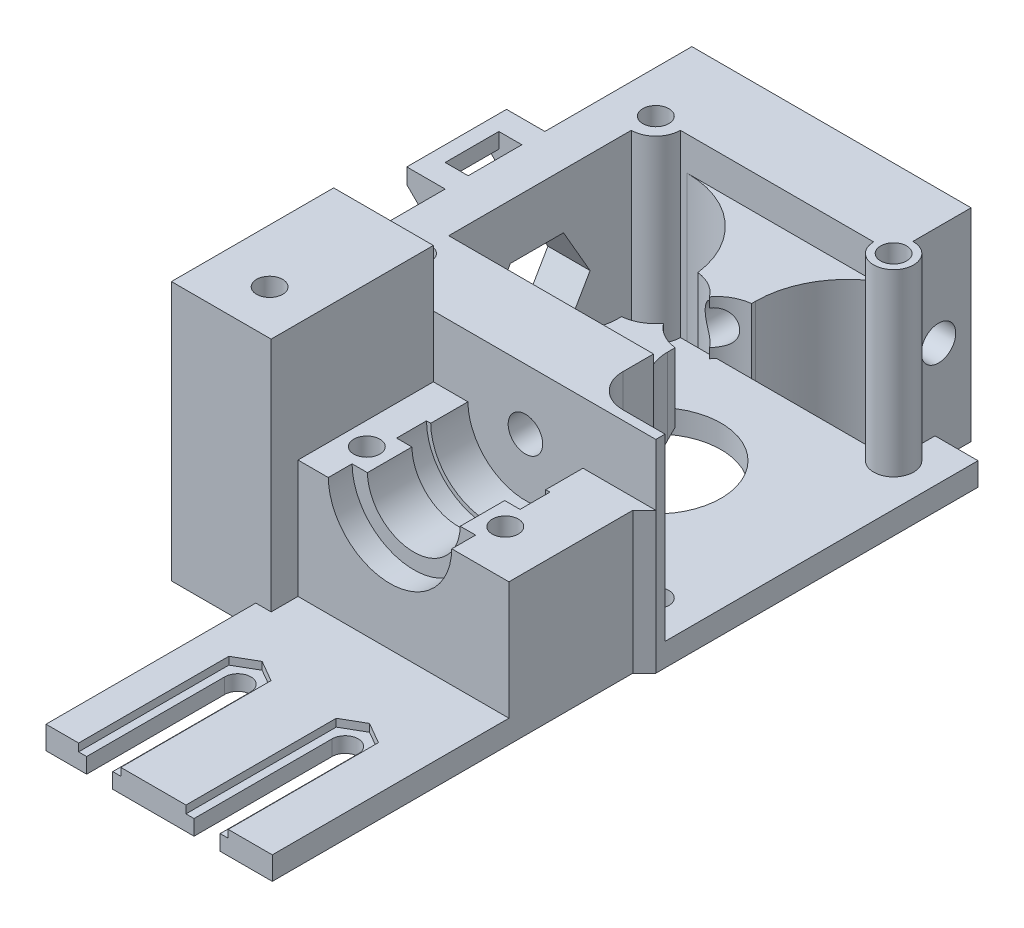
from build123d import *

# Parameters (mm, degrees)
SKETCH1_W                        = 42
SKETCH1_H                        = 90.5
SKETCH1_R                        = 8.5
BOSS_EXTRUDE1_DEPTH              = 3
SKETCH2_W                        = 24
SKETCH2_H                        = 16.65
BOSS_EXTRUDE2_DEPTH              = 15.5
SKETCH3_R                        = 6.05
CUT_EXTRUDE1_DEPTH               = 3.85
CUT_EXTRUDE2_START               = -3.85
SKETCH3_3_R                      = 8.05
CUT_EXTRUDE2_DEPTH               = 3.9
CUT_EXTRUDE3_START               = -7.75
SKETCH3_4_R                      = 6.05
CUT_EXTRUDE3_DEPTH               = 5.8
CUT_EXTRUDE4_START               = -13.55
SKETCH3_5_R                      = 8.05
CUT_EXTRUDE4_DEPTH               = 3.1
SKETCH4_R                        = 1.7
CUT_EXTRUDE5_DEPTH               = 114.237582101
SKETCH5_W                        = 13
SKETCH5_H                        = 20.15
BOSS_EXTRUDE3_DEPTH              = 30.8
CUT_EXTRUDE6_START               = 15.5
SKETCH2_2_W                      = 24
SKETCH2_2_H                      = 16.65
CUT_EXTRUDE6_DEPTH               = 0.1
CUT_EXTRUDE7_START               = 30.8
SKETCH5_5_R                      = 1.7
CUT_EXTRUDE7_DEPTH               = 147.684166304
SKETCH6_R                        = 3.25
CUT_EXTRUDE8_DEPTH               = 12.5
SKETCH7_R                        = 3.25
CUT_EXTRUDE9_DEPTH               = 3
SKETCH8_W                        = 3.5
SKETCH8_H                        = 16.65
BOSS_EXTRUDE4_DEPTH              = 15.4
SKETCH9_W                        = 1.5
SKETCH9_H                        = 48.5
CUT_EXTRUDE10_DEPTH              = 116.884166304
SKETCH19_R                       = 1.7
BOSS_EXTRUDE13_DEPTH             = 23.4
CUT_EXTRUDE20_DEPTH              = 120.590676894
CUT_EXTRUDE20_DEPTH_BACK         = 120.590676894
SKETCH19_3_R                     = 1.7
CUT_EXTRUDE21_START              = -12.5
SKETCH24_W                       = 3.4
SKETCH24_H                       = 3.4
CUT_EXTRUDE21_DEPTH              = 0.2
CUT_EXTRUDE22_START              = -3
SKETCH24_3_W                     = 3.4
SKETCH24_3_H                     = 3.4
CUT_EXTRUDE22_DEPTH              = 0.2
CUT_EXTRUDE23_START              = -12.9
SKETCH24_4_W                     = 3.4
SKETCH24_4_H                     = 3.4
CUT_EXTRUDE23_DEPTH              = 0.2
CUT_EXTRUDE24_START              = -3.4
SKETCH24_5_W                     = 3.4
SKETCH24_5_H                     = 3.4
CUT_EXTRUDE24_DEPTH              = 0.2
BOSS_EXTRUDE15_REACH             = 101.272
SKETCH26_W                       = 7
SKETCH26_H                       = 7
BOSS_EXTRUDE15_DIRECTION_2_REACH = 101.272
RIB1_REACH                       = 106.07
SKETCH28_WALL_W                  = 222.159999482
SKETCH28_WALL_H                  = 7
RIB11_START                      = -3.5
RIB11_DEPTH                      = 7
SKETCH29_R                       = 2.25
CUT_EXTRUDE25_DEPTH              = 89.232307008
SKETCH30_W                       = 36.4
SKETCH30_H                       = 4.7
BOSS_EXTRUDE16_DEPTH             = 3
SKETCH31_R                       = 2.25
CUT_EXTRUDE26_DEPTH              = 110.40511871
CUT_EXTRUDE27_START              = -7
SKETCH32_R                       = 2.25
CUT_EXTRUDE27_DEPTH              = 3
BOSS_EXTRUDE17_START             = 1
BOSS_EXTRUDE17_DEPTH             = 1
CUT_EXTRUDE28_DEPTH              = 3
CUT_EXTRUDE29_DEPTH              = 1
SKETCH36_R                       = 7.5
CUT_EXTRUDE30_DEPTH              = 4.85
CUT_EXTRUDE34_DEPTH              = 18
FILLET1_R                        = 6
FILLET2_R                        = 12
CUT_EXTRUDE36_START              = -10
SKETCH42_R                       = 6.5
SKETCH42_R_2                     = 5
CUT_EXTRUDE36_DEPTH              = 5
CUT_EXTRUDE37_DEPTH              = 5.5
BOSS_EXTRUDE18_START             = 14.535898
BOSS_EXTRUDE18_DEPTH             = 3
LPATTERN1_COUNT                  = 2
LPATTERN1_PITCH                  = 10
SKETCH46_W                       = 2
SKETCH46_H                       = 2
BOSS_EXTRUDE19_DEPTH             = 7
CHAMFER1_SIZE                    = 1.5
SKETCH48_R                       = 1.5
CUT_EXTRUDE38_DEPTH              = 3
SKETCH49_W                       = 11
SKETCH49_H                       = 27.35
CUT_EXTRUDE39_DEPTH              = 120.590676974


with BuildPart() as part:
    # Sketch1 → Boss-Extrude1 (new body)
    with BuildSketch(Plane(origin=(0, 0, 0), x_dir=(1, 0, 0), z_dir=(0, 1, 0))):
        with Locations((44.5, 45.25)):
            Rectangle(SKETCH1_W, SKETCH1_H)
        with Locations(Location((44.5, 69.5, 0), (0, 0, 270))):
            Circle(SKETCH1_R, mode=Mode.SUBTRACT)
    extrude(amount=BOSS_EXTRUDE1_DEPTH)

    # Sketch2 → Boss-Extrude2 (add)
    with BuildSketch(Plane(origin=(0, 3, 0), x_dir=(1, 0, 0), z_dir=(0, 1, 0))):
        with Locations((48.5, 39.175)):
            Rectangle(SKETCH2_W, SKETCH2_H)
    extrude(amount=BOSS_EXTRUDE2_DEPTH)

    # Sketch3 → Cut-Extrude1 (cut)
    with BuildSketch(Plane(origin=(0, 0, -47.5), x_dir=(-1, 0, 0), z_dir=(0, 0, -1))):
        with Locations((-48.5, 18.5)):
            Circle(SKETCH3_R)
    extrude(amount=-CUT_EXTRUDE1_DEPTH, mode=Mode.SUBTRACT)

    # Sketch3<3> → Cut-Extrude2 (cut)
    with BuildSketch(Plane(origin=(0, 0, -47.5), x_dir=(-1, 0, 0), z_dir=(0, 0, -1)).offset(CUT_EXTRUDE2_START)):
        with Locations((-48.5, 18.5)):
            Circle(SKETCH3_3_R)
    extrude(amount=-CUT_EXTRUDE2_DEPTH, mode=Mode.SUBTRACT)

    # Sketch3<4> → Cut-Extrude3 (cut)
    with BuildSketch(Plane(origin=(0, 0, -47.5), x_dir=(-1, 0, 0), z_dir=(0, 0, -1)).offset(CUT_EXTRUDE3_START)):
        with Locations((-48.5, 18.5)):
            Circle(SKETCH3_4_R)
    extrude(amount=-CUT_EXTRUDE3_DEPTH, mode=Mode.SUBTRACT)

    # Sketch3<5> → Cut-Extrude4 (cut)
    with BuildSketch(Plane(origin=(0, 0, -47.5), x_dir=(-1, 0, 0), z_dir=(0, 0, -1)).offset(CUT_EXTRUDE4_START)):
        with Locations((-48.5, 18.5)):
            Circle(SKETCH3_5_R)
    extrude(amount=-CUT_EXTRUDE4_DEPTH, mode=Mode.SUBTRACT)

    # Sketch4 → Cut-Extrude5 (cut, through all)
    with BuildSketch(Plane(origin=(0, 18.5, 0), x_dir=(1, 0, 0), z_dir=(0, 1, 0))):
        with Locations(Location((39.475, 36.85, 0), (0, 0, 270))):
            Circle(SKETCH4_R)
        with Locations(Location((57.525, 36.85, 0), (0, 0, 270))):
            Circle(SKETCH4_R)
    extrude(amount=-CUT_EXTRUDE5_DEPTH, mode=Mode.SUBTRACT)

    # Sketch5 → Boss-Extrude3 (add)
    with BuildSketch(Plane(origin=(0, 3, 0), x_dir=(1, 0, 0), z_dir=(0, 1, 0))):
        with Locations((30, 37.425)):
            Rectangle(SKETCH5_W, SKETCH5_H)
    extrude(amount=BOSS_EXTRUDE3_DEPTH)

    # Sketch2<2> → Cut-Extrude6 (cut)
    with BuildSketch(Plane(origin=(0, 3, 0), x_dir=(1, 0, 0), z_dir=(0, 1, 0)).offset(CUT_EXTRUDE6_START)):
        with Locations((48.5, 39.175)):
            Rectangle(SKETCH2_2_W, SKETCH2_2_H)
    extrude(amount=-CUT_EXTRUDE6_DEPTH, mode=Mode.SUBTRACT)

    # Sketch5<5> → Cut-Extrude7 (cut, through all)
    with BuildSketch(Plane(origin=(0, 3, 0), x_dir=(1, 0, 0), z_dir=(0, 1, 0)).offset(CUT_EXTRUDE7_START)):
        with Locations(Location((30.5, 33.15, 0), (0, 0, 270))):
            Circle(SKETCH5_5_R)
    extrude(amount=-CUT_EXTRUDE7_DEPTH, mode=Mode.SUBTRACT)

    # Sketch6 → Cut-Extrude8 (cut)
    with BuildSketch(Plane(origin=(0, 0, 0), x_dir=(-1, 0, 0), z_dir=(0, -1, 0))):
        with Locations(Location((-30.5, 33.15, 0), (0, 0, 90))):
            Circle(SKETCH6_R)
    extrude(amount=-CUT_EXTRUDE8_DEPTH, mode=Mode.SUBTRACT)

    # Sketch7 → Cut-Extrude9 (cut)
    with BuildSketch(Plane(origin=(0, 0, 0), x_dir=(-1, 0, 0), z_dir=(0, -1, 0))):
        with Locations(Location((-39.475, 36.85, 0), (0, 0, 90))):
            Circle(SKETCH7_R)
        with Locations(Location((-57.525, 36.85, 0), (0, 0, 90))):
            Circle(SKETCH7_R)
    extrude(amount=-CUT_EXTRUDE9_DEPTH, mode=Mode.SUBTRACT)

    # Sketch8 → Boss-Extrude4 (add)
    with BuildSketch(Plane(origin=(0, 3, 0), x_dir=(1, 0, 0), z_dir=(0, 1, 0))):
        with Locations((62.25, 39.175)):
            Rectangle(SKETCH8_W, SKETCH8_H)
    extrude(amount=BOSS_EXTRUDE4_DEPTH)

    # Sketch9 → Cut-Extrude10 (cut, through all)
    with BuildSketch(Plane(origin=(0, 3, 0), x_dir=(1, 0, 0), z_dir=(0, 1, 0))):
        with Locations((64.75, 24.25)):
            Rectangle(SKETCH9_W, SKETCH9_H)
    extrude(amount=-CUT_EXTRUDE10_DEPTH, mode=Mode.SUBTRACT)

    # Sketch19 → Boss-Extrude13 (add)
    with BuildSketch(Plane(origin=(0, 3, 0), x_dir=(1, 0, 0), z_dir=(0, 1, 0))):
        with BuildLine():
            Line((23.5, 48.5), (65.5, 48.5))
            Line((65.5, 48.5), (65.5, 49.7))
            Line((65.5, 49.7), (60, 49.7))
            ThreePointArc((60, 49.7), (56.959440841, 50.959440841), (55.7, 54))
            Line((55.7, 54), (55.7, 58))
            Line((55.7, 58), (29, 58))
            Line((29, 58), (29, 81.8))
            ThreePointArc((29, 81.8), (31.2627417, 82.7372583), (32.2, 85))
            Line((32.2, 85), (57.4, 85))
            ThreePointArc((57.4, 85), (61.8734994, 83.197224362), (59.9, 87.598076211))
            Line((59.9, 87.598076211), (59.9, 95.2))
            Line((59.9, 95.2), (23.5, 95.2))
            Line((23.5, 95.2), (23.5, 48.5))
        make_face()
        with Locations(Location((29, 85, 0), (0, 0, 270))):
            Circle(SKETCH19_R, mode=Mode.SUBTRACT)
        with Locations(Location((60, 85, 0), (0, 0, 270))):
            Circle(SKETCH19_R, mode=Mode.SUBTRACT)
    extrude(amount=BOSS_EXTRUDE13_DEPTH)

    # Sketch19<3> → Cut-Extrude20 (cut, two sides: drawn at the far end of the back side and taken through both)
    with BuildSketch(Plane(origin=(0, 3, 0), x_dir=(1, 0, 0), z_dir=(0, 1, 0)).offset(-CUT_EXTRUDE20_DEPTH_BACK)):
        with Locations(Location((29, 85, 0), (0, 0, 270))):
            Circle(SKETCH19_3_R)
        with Locations(Location((60, 85, 0), (0, 0, 270))):
            Circle(SKETCH19_3_R)
        with Locations(Location((29, 54, 0), (0, 0, 270))):
            Circle(SKETCH19_3_R)
        with Locations(Location((60, 54, 0), (0, 0, 270))):
            Circle(SKETCH19_3_R)
    extrude(amount=CUT_EXTRUDE20_DEPTH + CUT_EXTRUDE20_DEPTH_BACK, mode=Mode.SUBTRACT)

    # Sketch24 → Cut-Extrude21 (cut)
    with BuildSketch(Plane.XZ.offset(CUT_EXTRUDE21_START)):
        with BuildLine():
            Line((33.269927797, -31.45), (32.2, -31.45))
            Line((32.2, -31.45), (32.2, -34.85))
            Line((32.2, -34.85), (33.269927797, -34.85))
            ThreePointArc((33.269927797, -34.85), (33.627680078, -34.033242509), (33.75, -33.15))
            ThreePointArc((33.75, -33.15), (33.627680078, -32.266757491), (33.269927797, -31.45))
        make_face()
        with Locations((30.5, -33.15)):
            Rectangle(SKETCH24_W, SKETCH24_H)
        with BuildLine():
            Line((28.8, -34.85), (28.8, -31.45))
            Line((28.8, -31.45), (27.730072203, -31.45))
            ThreePointArc((27.730072203, -31.45), (27.372319922, -32.266757491), (27.25, -33.15))
            ThreePointArc((27.25, -33.15), (27.372319922, -34.033242509), (27.730072203, -34.85))
            Line((27.730072203, -34.85), (28.8, -34.85))
        make_face()
    extrude(amount=-CUT_EXTRUDE21_DEPTH, mode=Mode.SUBTRACT)

    # Sketch24<3> → Cut-Extrude22 (cut)
    with BuildSketch(Plane.XZ.offset(CUT_EXTRUDE22_START)):
        with BuildLine():
            Line((42.244927797, -35.15), (41.175, -35.15))
            Line((41.175, -35.15), (41.175, -38.55))
            Line((41.175, -38.55), (42.244927797, -38.55))
            ThreePointArc((42.244927797, -38.55), (42.602680078, -37.733242509), (42.725, -36.85))
            ThreePointArc((42.725, -36.85), (42.602680078, -35.966757491), (42.244927797, -35.15))
        make_face()
        with Locations((39.475, -36.85)):
            Rectangle(SKETCH24_3_W, SKETCH24_3_H)
        with BuildLine():
            Line((37.775, -38.55), (37.775, -35.15))
            Line((37.775, -35.15), (36.705072203, -35.15))
            ThreePointArc((36.705072203, -35.15), (36.347319922, -35.966757491), (36.225, -36.85))
            ThreePointArc((36.225, -36.85), (36.347319922, -37.733242509), (36.705072203, -38.55))
            Line((36.705072203, -38.55), (37.775, -38.55))
        make_face()
        with BuildLine():
            Line((55.825, -38.55), (55.825, -35.15))
            Line((55.825, -35.15), (54.755072203, -35.15))
            ThreePointArc((54.755072203, -35.15), (54.397319922, -35.966757491), (54.275, -36.85))
            ThreePointArc((54.275, -36.85), (54.397319922, -37.733242509), (54.755072203, -38.55))
            Line((54.755072203, -38.55), (55.825, -38.55))
        make_face()
        with Locations((57.525, -36.85)):
            Rectangle(SKETCH24_3_W, SKETCH24_3_H)
        with BuildLine():
            Line((60.294927797, -35.15), (59.225, -35.15))
            Line((59.225, -35.15), (59.225, -38.55))
            Line((59.225, -38.55), (60.294927797, -38.55))
            ThreePointArc((60.294927797, -38.55), (60.652680078, -37.733242509), (60.775, -36.85))
            ThreePointArc((60.775, -36.85), (60.652680078, -35.966757491), (60.294927797, -35.15))
        make_face()
    extrude(amount=-CUT_EXTRUDE22_DEPTH, mode=Mode.SUBTRACT)

    # Sketch24<4> → Cut-Extrude23 (cut)
    with BuildSketch(Plane.XZ.offset(CUT_EXTRUDE23_START)):
        with BuildLine():
            Line((32.2, -34.85), (28.8, -34.85))
            Line((28.8, -34.85), (28.8, -35.919927797))
            ThreePointArc((28.8, -35.919927797), (29.616757491, -36.277680078), (30.5, -36.4))
            ThreePointArc((30.5, -36.4), (31.383242509, -36.277680078), (32.2, -35.919927797))
            Line((32.2, -35.919927797), (32.2, -34.85))
        make_face()
        with BuildLine():
            ThreePointArc((32.2, -30.380072203), (31.383242509, -30.022319922), (30.5, -29.9))
            ThreePointArc((30.5, -29.9), (29.616757491, -30.022319922), (28.8, -30.380072203))
            Line((28.8, -30.380072203), (28.8, -31.45))
            Line((28.8, -31.45), (32.2, -31.45))
            Line((32.2, -31.45), (32.2, -30.380072203))
        make_face()
        with Locations((30.5, -33.15)):
            Rectangle(SKETCH24_4_W, SKETCH24_4_H)
    extrude(amount=CUT_EXTRUDE23_DEPTH, mode=Mode.SUBTRACT)

    # Sketch24<5> → Cut-Extrude24 (cut)
    with BuildSketch(Plane.XZ.offset(CUT_EXTRUDE24_START)):
        with BuildLine():
            Line((41.175, -38.55), (37.775, -38.55))
            Line((37.775, -38.55), (37.775, -39.619927797))
            ThreePointArc((37.775, -39.619927797), (38.591757491, -39.977680078), (39.475, -40.1))
            ThreePointArc((39.475, -40.1), (40.358242509, -39.977680078), (41.175, -39.619927797))
            Line((41.175, -39.619927797), (41.175, -38.55))
        make_face()
        with Locations((39.475, -36.85)):
            Rectangle(SKETCH24_5_W, SKETCH24_5_H)
        with BuildLine():
            ThreePointArc((41.175, -34.080072203), (40.358242509, -33.722319922), (39.475, -33.6))
            ThreePointArc((39.475, -33.6), (38.591757491, -33.722319922), (37.775, -34.080072203))
            Line((37.775, -34.080072203), (37.775, -35.15))
            Line((37.775, -35.15), (41.175, -35.15))
            Line((41.175, -35.15), (41.175, -34.080072203))
        make_face()
        with BuildLine():
            Line((59.225, -38.55), (55.825, -38.55))
            Line((55.825, -38.55), (55.825, -39.619927797))
            ThreePointArc((55.825, -39.619927797), (56.641757491, -39.977680078), (57.525, -40.1))
            ThreePointArc((57.525, -40.1), (58.408242509, -39.977680078), (59.225, -39.619927797))
            Line((59.225, -39.619927797), (59.225, -38.55))
        make_face()
        with Locations((57.525, -36.85)):
            Rectangle(SKETCH24_5_W, SKETCH24_5_H)
        with BuildLine():
            ThreePointArc((59.225, -34.080072203), (58.408242509, -33.722319922), (57.525, -33.6))
            ThreePointArc((57.525, -33.6), (56.641757491, -33.722319922), (55.825, -34.080072203))
            Line((55.825, -34.080072203), (55.825, -35.15))
            Line((55.825, -35.15), (59.225, -35.15))
            Line((59.225, -35.15), (59.225, -34.080072203))
        make_face()
    extrude(amount=CUT_EXTRUDE24_DEPTH, mode=Mode.SUBTRACT)

    # Boss-Extrude15: up to this face of the body (flat: up to its plane)
    boss_extrude15_end = Plane(part.part.faces().sort_by_distance((42.35, 14.7, -58))[0])
    # Sketch26 → Boss-Extrude15 (add, up to the picked face)
    with BuildSketch(Plane.XY.offset(-66.5), mode=Mode.PRIVATE) as boss_extrude15_sk1:
        with Locations((48.5, 18.5)):
            Rectangle(SKETCH26_W, SKETCH26_H)
    boss_extrude15_tool1 = split(extrude(boss_extrude15_sk1.sketch, amount=BOSS_EXTRUDE15_REACH, mode=Mode.PRIVATE), bisect_by=boss_extrude15_end, keep=Keep.BOTH, mode=Mode.PRIVATE)
    add(boss_extrude15_tool1.solids().sort_by(Axis((48.5, 18.5, -66.5), (0, 0, 1)))[0])

    # Boss-Extrude15 direction 2: up to this face of the body (flat: up to its plane)
    boss_extrude15_direction_2_end = Plane(part.part.faces().sort_by_distance((44.8, 14.7, -85))[0])
    # Sketch26 → Boss-Extrude15 direction 2 (add, up to the picked face)
    with BuildSketch(Plane.XY.offset(-66.5), mode=Mode.PRIVATE) as boss_extrude15_direction_2_sk1:
        with Locations((48.5, 18.5)):
            Rectangle(SKETCH26_W, SKETCH26_H)
    boss_extrude15_direction_2_tool1 = split(extrude(boss_extrude15_direction_2_sk1.sketch, amount=-BOSS_EXTRUDE15_DIRECTION_2_REACH, mode=Mode.PRIVATE), bisect_by=boss_extrude15_direction_2_end, keep=Keep.BOTH, mode=Mode.PRIVATE)
    add(boss_extrude15_direction_2_tool1.solids().sort_by(Axis((48.5, 18.5, -66.5), (0, 0, -1)))[0])

    # Sketch28 wall → Rib1 (add, up to next)
    with BuildSketch(Plane(origin=(48.5, 10.75, -62.25), x_dir=(0, -0.707106781187, 0.707106781187), z_dir=(0, -0.707106781187, -0.707106781187)), mode=Mode.PRIVATE) as rib1_sk1:
        Rectangle(SKETCH28_WALL_W, SKETCH28_WALL_H)
    rib1_tool1 = extrude(rib1_sk1.sketch, amount=-RIB1_REACH, mode=Mode.PRIVATE) - part.part
    add(rib1_tool1.solids().sort_by_distance((48.5, 10.75, -62.25))[0])

    # Rib11: read off the stored shape, not the designer's step
    # Rib11 outline → Rib11 (add)
    with BuildSketch(Plane(origin=(48.5, 0, 0), x_dir=(0, 0, -1), z_dir=(1, 0, 0)).offset(RIB11_START)):
        Polygon((73, 15), (85, 3), (85, 15), align=None)
    extrude(amount=RIB11_DEPTH)

    # Sketch29 → Cut-Extrude25 (cut, through all)
    with BuildSketch(Plane.XY.offset(-48.5)):
        with Locations((48.5, 18.5)):
            Circle(SKETCH29_R)
    extrude(amount=-CUT_EXTRUDE25_DEPTH, mode=Mode.SUBTRACT)

    # Sketch30 → Boss-Extrude16 (add)
    with BuildSketch(Plane.XZ):
        with Locations((41.7, -92.85)):
            Rectangle(SKETCH30_W, SKETCH30_H)
    extrude(amount=-BOSS_EXTRUDE16_DEPTH)

    # Sketch31 → Cut-Extrude26 (cut, through all)
    with BuildSketch(Plane.ZY.offset(-23.5)):
        with Locations((-90.95, 13.25)):
            Circle(SKETCH31_R)
    extrude(amount=-CUT_EXTRUDE26_DEPTH, mode=Mode.SUBTRACT)

    # Sketch32 → Cut-Extrude27 (cut)
    # profile 1 of 4: a face of its own
    with BuildSketch(Plane(origin=(59.9, 0, 0), x_dir=(0, 0, -1), z_dir=(1, 0, 0)).offset(CUT_EXTRUDE27_START)):
        Polygon((94.991451884, 13.25), (92.970725942, 16.75), (88.929274058, 16.75), (87.598076211, 14.444297695), (87.598076211, 12.055702305), (88.929274058, 9.75), (92.970725942, 9.75), align=None)
        with Locations(Location((90.95, 13.25, 0), (0, 0, 180))):
            Circle(SKETCH32_R, mode=Mode.SUBTRACT)
    # profile 2 of 4: a face of its own
    with BuildSketch(Plane(origin=(59.9, 0, 0), x_dir=(0, 0, -1), z_dir=(1, 0, 0)).offset(CUT_EXTRUDE27_START)):
        Polygon((95.2, 16.75), (92.970725942, 16.75), (94.991451884, 13.25), (92.970725942, 9.75), (95.2, 9.75), align=None)
    # profile 3 of 4: a face of its own
    with BuildSketch(Plane(origin=(59.9, 0, 0), x_dir=(0, 0, -1), z_dir=(1, 0, 0)).offset(CUT_EXTRUDE27_START)):
        Polygon((95.2, 16.75), (92.970725942, 16.75), (94.991451884, 13.25), (92.970725942, 9.75), (95.2, 9.75), align=None)
    # profile 4 of 4: a face of its own
    with BuildSketch(Plane(origin=(59.9, 0, 0), x_dir=(0, 0, -1), z_dir=(1, 0, 0)).offset(CUT_EXTRUDE27_START)):
        Polygon((87.598076211, 12.055702305), (87.598076211, 14.444297695), (86.908548116, 13.25), align=None)
    extrude(amount=CUT_EXTRUDE27_DEPTH, mode=Mode.SUBTRACT)

    # Sketch33 → Boss-Extrude17 (add)
    with BuildSketch(Plane(origin=(0, 0, -47.5), x_dir=(-1, 0, 0), z_dir=(0, 0, -1)).offset(BOSS_EXTRUDE17_START)):
        with BuildLine():
            Line((-64, 3), (-23.5, 3))
            Line((-23.5, 3), (-23.5, 33.8))
            Line((-23.5, 33.8), (-36.5, 33.8))
            Line((-36.5, 33.8), (-36.5, 18.4))
            Line((-36.5, 18.4), (-42.450826503, 18.4))
            ThreePointArc((-42.450826503, 18.4), (-48.5, 12.45), (-54.549173497, 18.4))
            Line((-54.549173497, 18.4), (-64, 18.4))
            Line((-64, 18.4), (-64, 3))
        make_face()
    extrude(amount=-BOSS_EXTRUDE17_DEPTH)

    # Sketch34 → Cut-Extrude28 (cut)
    with BuildSketch(Plane.XZ):
        with BuildLine():
            Line((57.2, 0), (57.2, -18))
            ThreePointArc((57.2, -18), (55.5, -19.7), (53.8, -18))
            Line((53.8, -18), (53.8, 0))
            ThreePointArc((53.8, 0), (55.5, 1.7), (57.2, 0))
        make_face()
        with BuildLine():
            Line((43.2, 0), (43.2, -18))
            ThreePointArc((43.2, -18), (41.5, -19.7), (39.8, -18))
            Line((39.8, -18), (39.8, 0))
            ThreePointArc((39.8, 0), (41.5, 1.7), (43.2, 0))
        make_face()
    extrude(amount=-CUT_EXTRUDE28_DEPTH, mode=Mode.SUBTRACT)

    # Sketch35 → Cut-Extrude29 (cut)
    with BuildSketch(Plane(origin=(0, 3, 0), x_dir=(1, 0, 0), z_dir=(0, 1, 0))):
        Polygon((38.75, 1.58771324), (38.75, 16.41228676), (38.75, 19.58771324), (41.5, 21.175426481), (44.25, 19.58771324), (44.25, 16.41228676), (44.25, 1.58771324), (44.25, -1.58771324), (41.5, -3.175426481), (38.75, -1.58771324), align=None)
        Polygon((58.25, 19.58771324), (55.5, 21.175426481), (52.75, 19.58771324), (52.75, 16.41228676), (52.75, 1.58771324), (52.75, -1.58771324), (55.5, -3.175426481), (58.25, -1.58771324), (58.25, 1.58771324), (58.25, 16.41228676), align=None)
    extrude(amount=-CUT_EXTRUDE29_DEPTH, mode=Mode.SUBTRACT)

    # Sketch36 → Cut-Extrude30 (cut)
    with BuildSketch(Plane.XY.offset(-43.65)):
        with Locations((48.5, 18.5)):
            Circle(SKETCH36_R)
    extrude(amount=-CUT_EXTRUDE30_DEPTH, mode=Mode.SUBTRACT)

    # Sketch39 → Cut-Extrude34 (cut)
    with BuildSketch(Plane(origin=(0, 26.4, 0), x_dir=(1, 0, 0), z_dir=(0, 1, 0))):
        with BuildLine():
            ThreePointArc((48.5, 72.5), (39.5, 69.5), (48.5, 66.5))
            ThreePointArc((48.5, 66.5), (57.5, 69.5), (48.5, 72.5))
        make_face()
    extrude(amount=-CUT_EXTRUDE34_DEPTH, mode=Mode.SUBTRACT)

    # Fillet1
    # the kernel refuses this fillet: 6 mm, written as the material it adds along each edge
    with BuildSketch(Plane(origin=(52, 15, -58), x_dir=(1, 0, 0), z_dir=(0, -1, 0))) as fillet1_piece_1_section:
        with BuildLine():
            CenterArc((6, -5.541660401), FILLET1_R, 112.540310464, 67.459689536)
            Line((0, -5.541660401), (0, 0))
            Line((0, 0), (3.7, 0))
        make_face()
    fillet1_piece_1 = extrude(amount=22.354151002, mode=Mode.PRIVATE)
    fillet1_piece_1 = split(fillet1_piece_1, bisect_by=Plane(origin=(52, 10.75, -62.25), z_dir=(0, 0.7071067811865476, 0.7071067811865476)), keep=Keep.TOP, mode=Mode.PRIVATE)
    add(fillet1_piece_1)
    with BuildSketch(Plane(origin=(52, 15, -58), x_dir=(1, 0, 0), z_dir=(0, 1, 0))) as fillet1_piece_2:
        with BuildLine():
            CenterArc((6, 5.541660401), FILLET1_R, 180, 67.459689536)
            Line((0, 5.541660401), (0, 0))
            Line((0, 0), (3.7, 0))
        make_face()
    extrude(amount=7)
    with BuildSketch(Plane(origin=(45, 22, -58), x_dir=(-1, 0, 0), z_dir=(0, -1, 0))) as fillet1_piece_3_section:
        with BuildLine():
            CenterArc((FILLET1_R, FILLET1_R), FILLET1_R, 180, 90)
            Line((0, FILLET1_R), (0, 0))
            Line((0, 0), (FILLET1_R, 0))
        make_face()
    fillet1_piece_3 = extrude(amount=22, mode=Mode.PRIVATE)
    fillet1_piece_3 = split(fillet1_piece_3, bisect_by=Plane(origin=(45, 14.25, -65.75), z_dir=(0, 0.7071067811865476, 0.7071067811865476)), keep=Keep.TOP, mode=Mode.PRIVATE)
    add(fillet1_piece_3)

    # Fillet2
    # the kernel refuses this fillet: 12 mm, written as the material it adds along each edge
    with BuildSketch(Plane(origin=(52, -22.054939633, -85), x_dir=(0, 0, 1), z_dir=(0, 1, 0))) as fillet2_piece_1_section:
        with BuildLine():
            CenterArc((10.021975853, 12), FILLET2_R, 213.367012969, 56.632987031)
            Line((0, 5.4), (0, 0))
            Line((0, 0), (10.021975853, 0))
        make_face()
    fillet2_piece_1 = extrude(amount=37.054939633, mode=Mode.PRIVATE)
    fillet2_piece_1 = split(fillet2_piece_1, bisect_by=Plane(origin=(52, -9.527469816, -97.527469816), z_dir=(0, 0.7071067811865476, -0.7071067811865476)), keep=Keep.TOP, mode=Mode.PRIVATE)
    add(fillet2_piece_1)
    with BuildSketch(Plane(origin=(52, 15, -85), x_dir=(0, 0, 1), z_dir=(0, 1, 0))) as fillet2_piece_2:
        with BuildLine():
            CenterArc((10.021975853, 12), FILLET2_R, 213.367012969, 56.632987031)
            Line((0, 5.4), (0, 0))
            Line((0, 0), (10.021975853, 0))
        make_face()
    extrude(amount=7)
    with BuildSketch(Plane(origin=(45, 22, -85), x_dir=(0, 0, 1), z_dir=(0, -1, 0))) as fillet2_piece_3_section:
        with BuildLine():
            CenterArc((12, 11.909011726), FILLET2_R, 180, 82.939840434)
            Line((0, 11.909011726), (0, 0))
            Line((0, 0), (10.525062814, 0))
        make_face()
    fillet2_piece_3 = extrude(amount=36.772529316, mode=Mode.PRIVATE)
    fillet2_piece_3 = split(fillet2_piece_3, bisect_by=Plane(origin=(45, 12.5, -75.5), z_dir=(0, 0.7071067811865476, -0.7071067811865476)), keep=Keep.TOP, mode=Mode.PRIVATE)
    add(fillet2_piece_3)

    # Sketch42 → Cut-Extrude36 (cut)
    with BuildSketch(Plane.XY.offset(-27.35).offset(CUT_EXTRUDE36_START)):
        with Locations((23.5, 22.8)):
            Circle(SKETCH42_R)
        with Locations((23.5, 22.8)):
            Circle(SKETCH42_R_2, mode=Mode.SUBTRACT)
    extrude(amount=-CUT_EXTRUDE36_DEPTH, mode=Mode.SUBTRACT)

    # Sketch43 → Cut-Extrude37 (cut)
    with BuildSketch(Plane.ZY.offset(-23.5)):
        Polygon((-66.035898385, 7.25), (-62.57179677, 13.25), (-66.035898385, 19.25), (-72.964101615, 19.25), (-76.42820323, 13.25), (-72.964101615, 7.25), align=None)
    extrude(amount=-CUT_EXTRUDE37_DEPTH, mode=Mode.SUBTRACT)

    # Sketch45 → Boss-Extrude18 (add)
    with BuildSketch(Plane(origin=(0, 0, -48.5), x_dir=(-1, 0, 0), z_dir=(0, 0, -1)).offset(BOSS_EXTRUDE18_START)):
        Polygon((-23.5, 26.4), (-18.5, 26.4), (-18.5, 24.4), (-23.5, 19.4), align=None)
    boss_extrude18 = extrude(amount=BOSS_EXTRUDE18_DEPTH)

    # LPattern1: Boss-Extrude18 ×2
    with Locations(*[(0, 0, -i * LPATTERN1_PITCH) for i in range(1, LPATTERN1_COUNT)]):
        add(boss_extrude18)


with BuildPart() as boss_extrude19_tool:
    # Sketch46 → Boss-Extrude19 (new body)
    with BuildSketch(Plane(origin=(0, 0, -66.035898385), x_dir=(-1, 0, 0), z_dir=(0, 0, -1))):
        with Locations((-19.5, 25.4)):
            Rectangle(SKETCH46_W, SKETCH46_H)
    extrude(amount=BOSS_EXTRUDE19_DEPTH)


with BuildPart() as part_1:
    add(part.part)


with BuildPart() as part_2:
    # Boss-Extrude19: joined with boss_extrude19_tool
    add(part_1.part.fuse(boss_extrude19_tool.part, tol=0.00001))

    # Chamfer1
    chamfer1_edges = [part_2.edges().sort_by_distance(p)[0] for p in [
        (64, 9.2, -48.5),
    ]]
    chamfer(chamfer1_edges, length=CHAMFER1_SIZE - 0.0001)  # a hair under: the kernel refuses the full size

    # Sketch48 → Cut-Extrude38 (cut)
    with BuildSketch(Plane(origin=(0, 0, -95.2), x_dir=(-1, 0, 0), z_dir=(0, 0, -1))):
        with Locations((-37.9, 20.25)):
            Circle(SKETCH48_R)
        with Locations((-37.9, 6.25)):
            Circle(SKETCH48_R)
    extrude(amount=-CUT_EXTRUDE38_DEPTH, mode=Mode.SUBTRACT)

    # Sketch49 → Cut-Extrude39 (cut, through all)
    with BuildSketch(Plane(origin=(0, 3, 0), x_dir=(1, 0, 0), z_dir=(0, 1, 0))):
        with Locations((29, 13.675)):
            Rectangle(SKETCH49_W, SKETCH49_H)
    extrude(amount=-CUT_EXTRUDE39_DEPTH, mode=Mode.SUBTRACT)


solid = part_2.part
